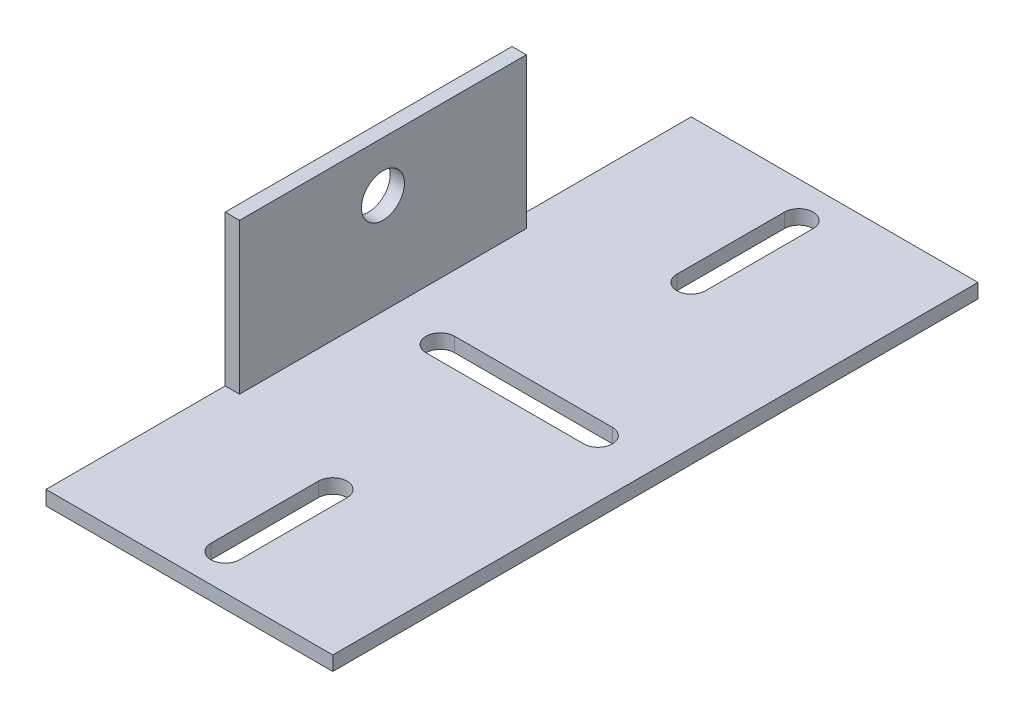
from build123d import *

# Parameters (mm, degrees)
EXTRUDE_1_DEPTH     = 90
CUT_EXTRUDE_1_DEPTH = 10
SKETCH_4_R          = 3
CUT_EXTRUDE_2_DEPTH = 10
SKETCH_5_W          = 25
SKETCH_5_H          = 21
CUT_EXTRUDE_3_DEPTH = 10


with BuildPart() as part:
    # Эскиз2 → Вытянуть-Тонкостенный1 (new body)
    with BuildSketch(Plane.XY):
        Polygon((0, 23), (0, 0), (40, 0), (40, 2), (2, 2), (2, 23), align=None)
    extrude(amount=EXTRUDE_1_DEPTH)

    # Эскиз3 → Вырез-Вытянуть1 (cut)
    with BuildSketch(Plane(origin=(0, 2, 0), x_dir=(1, 0, 0), z_dir=(0, 1, 0))):
        with BuildLine():
            Line((32, -43), (10, -43))
            ThreePointArc((10, -43), (8, -45), (10, -47))
            Line((10, -47), (32, -47))
            ThreePointArc((32, -47), (34, -45), (32, -43))
        make_face()
        with BuildLine():
            Line((18, -5), (18, -20))
            ThreePointArc((18, -20), (20, -22), (22, -20))
            Line((22, -20), (22, -5))
            ThreePointArc((22, -5), (20, -3), (18, -5))
        make_face()
        with BuildLine():
            Line((22, -85), (22, -70))
            ThreePointArc((22, -70), (20, -68), (18, -70))
            Line((18, -70), (18, -85))
            ThreePointArc((18, -85), (20, -87), (22, -85))
        make_face()
    extrude(amount=-CUT_EXTRUDE_1_DEPTH, mode=Mode.SUBTRACT)

    # Эскиз4 → Вырез-Вытянуть2 (cut)
    with BuildSketch(Plane.ZY):
        with Locations((45, 16)):
            Circle(SKETCH_4_R)
    extrude(amount=-CUT_EXTRUDE_2_DEPTH, mode=Mode.SUBTRACT)

    # Эскиз5 → Вырез-Вытянуть3 (cut)
    with BuildSketch(Plane.ZY):
        with Locations((12.5, 12.5)):
            Rectangle(SKETCH_5_W, SKETCH_5_H)
        with Locations((77.5, 12.5)):
            Rectangle(SKETCH_5_W, SKETCH_5_H)
    extrude(amount=-CUT_EXTRUDE_3_DEPTH, mode=Mode.SUBTRACT)


solid = part.part
